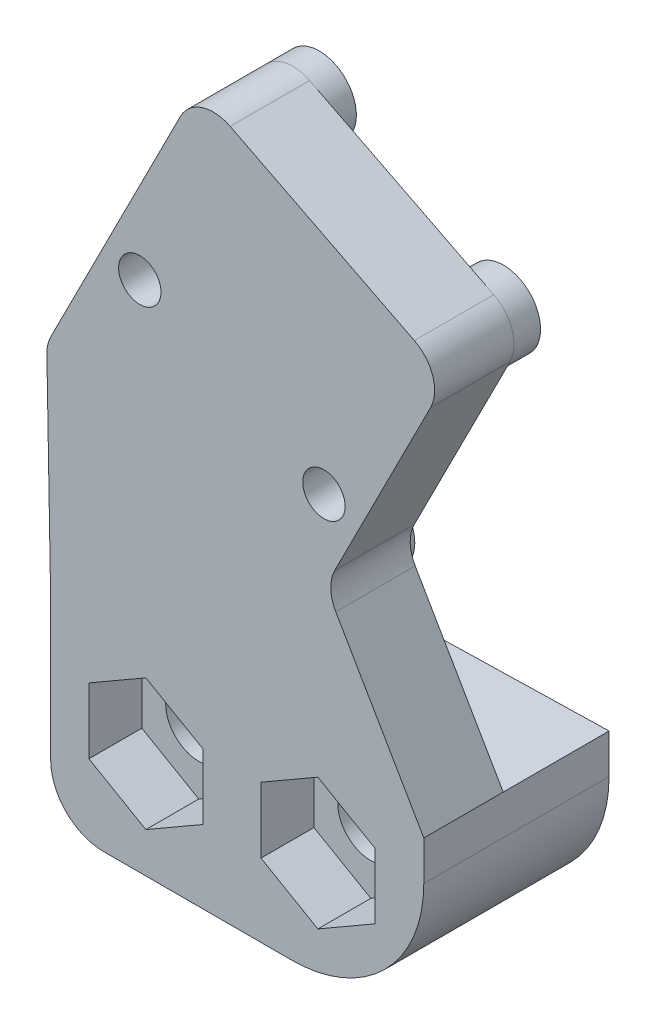
from build123d import *
from build123d.topology import SkipClean

# Parameters (mm, degrees)
SKETCH_1_R          = 1.25
SKETCH_1_R_2        = 0.8
EXTRUDE_1_DEPTH     = 3
SKETCH_1_3_R        = 1.4
EXTRUDE_2_DEPTH     = 1
EXTRUDE_START       = 4
SKETCH_2_R          = 1.25
EXTRUDE_4_DEPTH     = 4
CUT_EXTRUDE_1_DEPTH = 2
FILLET_5_R          = 1.4
FILLET_6_R          = 5
FILLET_7_R          = 2


with BuildPart() as part:
    # 草图1 → 凸台-拉伸1 (new body)
    with BuildSketch(Plane.XY):
        Polygon((-26.956782862, 10.467447756), (-12.862024989, 10.467447756), (-12.862024989, 16.960886275), (-16.568414577, 23.35481412), (-11.970079327, 32.421029044), (-21.423645563, 37.215826788), (-27.105390709, 26.013528601), (-26.956782862, 17.673670772), align=None)
        with Locations((-16.862024989, 14.467447756)):
            Circle(SKETCH_1_R, mode=Mode.SUBTRACT)
        with Locations((-23.362024989, 14.467447756)):
            Circle(SKETCH_1_R, mode=Mode.SUBTRACT)
        with Locations((-16.633826091, 26.320867889)):
            Circle(SKETCH_1_R_2, mode=Mode.SUBTRACT)
        with Locations((-23.590223888, 29.849115285)):
            Circle(SKETCH_1_R_2, mode=Mode.SUBTRACT)
    extrude(amount=EXTRUDE_1_DEPTH)

    # 草图1<3> → 凸台-拉伸2 (add)
    with BuildSketch(Plane.XY):
        with Locations((-13.85193872, 31.805719998)):
            Circle(SKETCH_1_3_R)
        with Locations((-20.808336517, 35.333967395)):
            Circle(SKETCH_1_3_R)
        with Locations((-25.55790032, 25.969585745)):
            Circle(SKETCH_1_3_R)
        with Locations((-18.601502523, 22.441338348)):
            Circle(SKETCH_1_3_R)
    extrude(amount=-EXTRUDE_2_DEPTH)

    # 草图2 → 凸台-拉伸4 (add)
    with SkipClean():  # the faces are left unmerged after this step: merging them gives an invalid solid
        with BuildSketch(Plane(origin=(0, 0, 0), x_dir=(-1, 0, 0), z_dir=(0, 0, -1)).offset(EXTRUDE_START)):
            Polygon((12.862024989, 16.960886275), (12.862024989, 10.467447756), (26.956782862, 10.467447756), (26.956782862, 16.548192736), (23.76212017, 16.548192736), (19.164921884, 16.813734876), align=None)
            with Locations((16.862024989, 14.467447756)):
                Circle(SKETCH_2_R, mode=Mode.SUBTRACT)
            with Locations((23.362024989, 14.467447756)):
                Circle(SKETCH_2_R, mode=Mode.SUBTRACT)
        extrude(amount=-EXTRUDE_4_DEPTH)

    # 草图3 → 切除-拉伸1 (cut)
    with BuildSketch(Plane.XY.offset(3)):
        Polygon((-23.362024989, 16.950053913), (-21.212024989, 15.708750835), (-21.212024989, 13.226144677), (-23.362024989, 11.984841598), (-25.512024989, 13.226144677), (-25.512024989, 15.708750835), align=None)
        Polygon((-16.862024989, 16.950053913), (-14.712024989, 15.708750835), (-14.712024989, 13.226144677), (-16.862024989, 11.984841598), (-19.012024989, 13.226144677), (-19.012024989, 15.708750835), align=None)
    extrude(amount=-CUT_EXTRUDE_1_DEPTH, mode=Mode.SUBTRACT)

    # 圆角5
    fillet_5_edges = [part.edges().sort_by_distance(p)[0] for p in [
        (-27.105390709, 26.013528601, 1.5),
        (-16.568414577, 23.35481412, 1.5),
        (-11.970079327, 32.421029044, 1.5),
        (-21.423645563, 37.215826788, 1.5),
    ]]
    fillet(fillet_5_edges, radius=FILLET_5_R - 0.0001)  # a hair under: the kernel refuses the full size

    # 圆角6
    fillet_6_edges = [part.edges().sort_by_distance(p)[0] for p in [
        (-12.862024989, 10.467447756, -0.5),
    ]]
    fillet(fillet_6_edges, radius=FILLET_6_R)

    # 圆角7
    fillet_7_edges = [part.edges().sort_by_distance(p)[0] for p in [
        (-26.956782862, 10.467447756, -0.5),
    ]]
    fillet(fillet_7_edges, radius=FILLET_7_R)


solid = part.part
